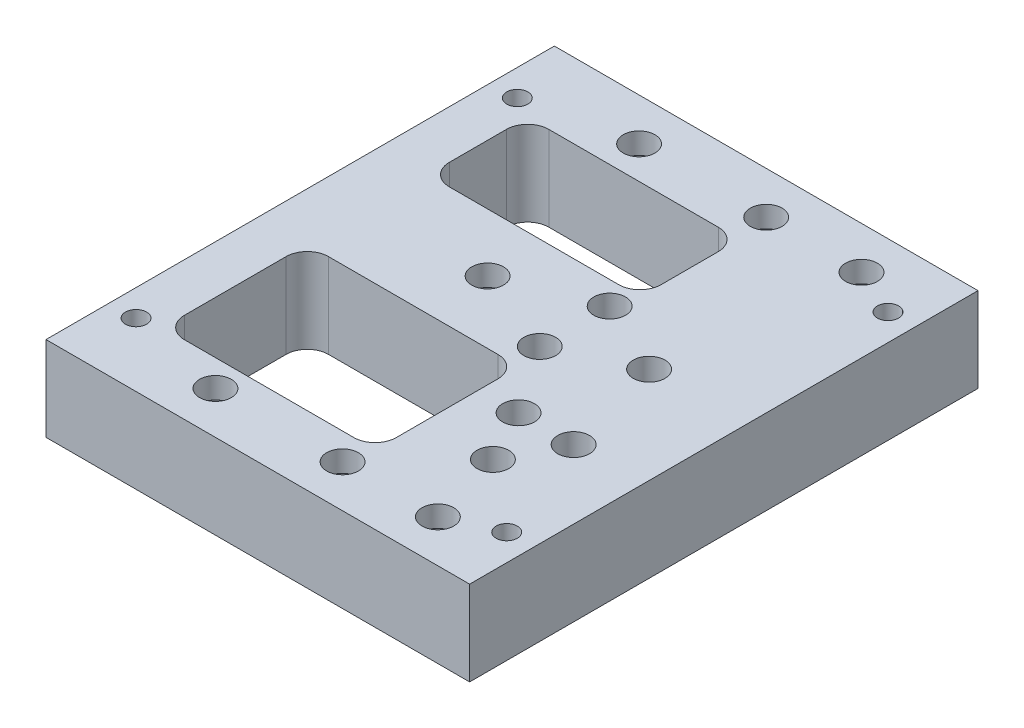
from build123d import *

# Parameters (mm, degrees)
SKETCH1_W                    = 200
SKETCH1_H                    = 240
BOSS_EXTRUDE1_DEPTH          = 40
CUT_EXTRUDE2_REACH           = 163.245
SKETCH3_R                    = 7.5
SKETCH4_R                    = 9
CUT_EXTRUDE3_DEPTH           = 5
SKETCH11_R                   = 7.5
CUT_EXTRUDE9_DEPTH           = 228.946346538
SKETCH12_R                   = 10
CUT_EXTRUDE10_DEPTH          = 5
SKETCH13_R                   = 10
CUT_EXTRUDE11_DEPTH          = 30
M10_TAPPED_HOLE1_D           = 8.5
M10_TAPPED_HOLE1_DEPTH       = 27.5
M10_TAPPED_HOLE1_CSINK_D     = 10.05
M10_TAPPED_HOLE1_CSINK_ANGLE = 90
M10_TAPPED_HOLE1_TIP         = 2.553657631
F_10_0MM_DOWEL_HOLE2_D       = 10
CUT_EXTRUDE12_REACH          = 163.245
SKETCH28_R                   = 7.5
SKETCH29_R                   = 9
CUT_EXTRUDE13_DEPTH          = 30


with BuildPart() as part:
    # Sketch1 → Boss-Extrude1 (new body)
    with BuildSketch(Plane(origin=(0, 0, 0), x_dir=(1, 0, 0), z_dir=(0, 1, 0))):
        Rectangle(SKETCH1_W, SKETCH1_H)
    extrude(amount=-BOSS_EXTRUDE1_DEPTH)

    # Sketch3 → Cut-Extrude2 (cut, up to next)
    with BuildSketch(Plane(origin=(0, 0, 0), x_dir=(1, 0, 0), z_dir=(0, 1, 0)), mode=Mode.PRIVATE) as cut_extrude2_sk1:
        with Locations((19.38, 26.73)):
            Circle(SKETCH3_R)
    cut_extrude2_tool1 = extrude(cut_extrude2_sk1.sketch, amount=-CUT_EXTRUDE2_REACH, mode=Mode.PRIVATE) & part.part
    # Sketch3 → Cut-Extrude2 (cut, up to next)
    with BuildSketch(Plane(origin=(0, 0, 0), x_dir=(1, 0, 0), z_dir=(0, 1, 0)), mode=Mode.PRIVATE) as cut_extrude2_sk2:
        with Locations((19.38, -6.27)):
            Circle(SKETCH3_R)
    cut_extrude2_tool2 = extrude(cut_extrude2_sk2.sketch, amount=-CUT_EXTRUDE2_REACH, mode=Mode.PRIVATE) & part.part
    # Sketch3 → Cut-Extrude2 (cut, up to next)
    with BuildSketch(Plane(origin=(0, 0, 0), x_dir=(1, 0, 0), z_dir=(0, 1, 0)), mode=Mode.PRIVATE) as cut_extrude2_sk3:
        with Locations((54.5, -63.53)):
            Circle(SKETCH3_R)
    cut_extrude2_tool3 = extrude(cut_extrude2_sk3.sketch, amount=-CUT_EXTRUDE2_REACH, mode=Mode.PRIVATE) & part.part
    # Sketch3 → Cut-Extrude2 (cut, up to next)
    with BuildSketch(Plane(origin=(0, 0, 0), x_dir=(1, 0, 0), z_dir=(0, 1, 0)), mode=Mode.PRIVATE) as cut_extrude2_sk4:
        with Locations((67.5, -38.4)):
            Circle(SKETCH3_R)
    cut_extrude2_tool4 = extrude(cut_extrude2_sk4.sketch, amount=-CUT_EXTRUDE2_REACH, mode=Mode.PRIVATE) & part.part
    # Sketch3 → Cut-Extrude2 (cut, up to next)
    with BuildSketch(Plane(origin=(0, 0, 0), x_dir=(1, 0, 0), z_dir=(0, 1, 0)), mode=Mode.PRIVATE) as cut_extrude2_sk5:
        with Locations((41.5, -38.4)):
            Circle(SKETCH3_R)
    cut_extrude2_tool5 = extrude(cut_extrude2_sk5.sketch, amount=-CUT_EXTRUDE2_REACH, mode=Mode.PRIVATE) & part.part
    # Sketch3 → Cut-Extrude2 (cut, up to next)
    with BuildSketch(Plane(origin=(0, 0, 0), x_dir=(1, 0, 0), z_dir=(0, 1, 0)), mode=Mode.PRIVATE) as cut_extrude2_sk6:
        with BuildLine():
            Line((-67.245, 84.63), (12.755, 84.63))
            ThreePointArc((12.755, 84.63), (19.826067812, 81.701067812), (22.755, 74.63))
            Line((22.755, 74.63), (22.755, 47.63))
            ThreePointArc((22.755, 47.63), (19.826067812, 40.558932188), (12.755, 37.63))
            Line((12.755, 37.63), (-67.245, 37.63))
            ThreePointArc((-67.245, 37.63), (-74.316067812, 40.558932188), (-77.245, 47.63))
            Line((-77.245, 47.63), (-77.245, 74.63))
            ThreePointArc((-77.245, 74.63), (-74.316067812, 81.701067812), (-67.245, 84.63))
        make_face()
    cut_extrude2_tool6 = extrude(cut_extrude2_sk6.sketch, amount=-CUT_EXTRUDE2_REACH, mode=Mode.PRIVATE) & part.part
    # Sketch3 → Cut-Extrude2 (cut, up to next)
    with BuildSketch(Plane(origin=(0, 0, 0), x_dir=(1, 0, 0), z_dir=(0, 1, 0)), mode=Mode.PRIVATE) as cut_extrude2_sk7:
        with BuildLine():
            Line((-67.245, -19.4), (12.755, -19.4))
            ThreePointArc((12.755, -19.4), (19.826067812, -22.328932188), (22.755, -29.4))
            Line((22.755, -29.4), (22.755, -77.4))
            ThreePointArc((22.755, -77.4), (19.826067812, -84.471067812), (12.755, -87.4))
            Line((12.755, -87.4), (-67.245, -87.4))
            ThreePointArc((-67.245, -87.4), (-74.316067812, -84.471067812), (-77.245, -77.4))
            Line((-77.245, -77.4), (-77.245, -29.4))
            ThreePointArc((-77.245, -29.4), (-74.316067812, -22.328932188), (-67.245, -19.4))
        make_face()
    cut_extrude2_tool7 = extrude(cut_extrude2_sk7.sketch, amount=-CUT_EXTRUDE2_REACH, mode=Mode.PRIVATE) & part.part
    add(cut_extrude2_tool1.solids().sort_by_distance((19.38, 0, -26.73))[0], mode=Mode.SUBTRACT)
    add(cut_extrude2_tool2.solids().sort_by_distance((19.38, 0, 6.27))[0], mode=Mode.SUBTRACT)
    add(cut_extrude2_tool3.solids().sort_by_distance((54.5, 0, 63.53))[0], mode=Mode.SUBTRACT)
    add(cut_extrude2_tool4.solids().sort_by_distance((67.5, 0, 38.4))[0], mode=Mode.SUBTRACT)
    add(cut_extrude2_tool5.solids().sort_by_distance((41.5, 0, 38.4))[0], mode=Mode.SUBTRACT)
    add(cut_extrude2_tool6.solids().sort_by_distance((-27.245, 0, -61.13))[0], mode=Mode.SUBTRACT)
    add(cut_extrude2_tool7.solids().sort_by_distance((-27.245, 0, 53.4))[0], mode=Mode.SUBTRACT)

    # Sketch4 → Cut-Extrude3 (cut)
    with BuildSketch(Plane.XZ.offset(40)):
        with Locations((19.38, -26.73)):
            Circle(SKETCH4_R)
        with Locations((19.38, 6.27)):
            Circle(SKETCH4_R)
        with Locations((41.5, 38.4)):
            Circle(SKETCH4_R)
        with Locations((67.5, 38.4)):
            Circle(SKETCH4_R)
        with Locations((54.5, 63.53)):
            Circle(SKETCH4_R)
    extrude(amount=-CUT_EXTRUDE3_DEPTH, mode=Mode.SUBTRACT)

    # Sketch11 → Cut-Extrude9 (cut, through all)
    with BuildSketch(Plane(origin=(89.63, 0, 0), x_dir=(1, 0, 0), z_dir=(0, 1, 0))):
        with Locations((-35.13, 10.23)):
            Circle(SKETCH11_R)
        with Locations((-111.38, 10.23)):
            Circle(SKETCH11_R)
    extrude(amount=-CUT_EXTRUDE9_DEPTH, mode=Mode.SUBTRACT)

    # Sketch12 → Cut-Extrude10 (cut)
    with BuildSketch(Plane(origin=(89.63, -40, 0), x_dir=(1, 0, 0), z_dir=(0, -1, 0))):
        with Locations((-35.13, -10.23)):
            Circle(SKETCH12_R)
    extrude(amount=-CUT_EXTRUDE10_DEPTH, mode=Mode.SUBTRACT)

    # Sketch13 → Cut-Extrude11 (cut)
    with BuildSketch(Plane(origin=(89.63, -40, 0), x_dir=(1, 0, 0), z_dir=(0, -1, 0))):
        with Locations((-111.38, -10.23)):
            Circle(SKETCH13_R)
    extrude(amount=-CUT_EXTRUDE11_DEPTH, mode=Mode.SUBTRACT)

    # M10 Tapped Hole1
    with Locations(Plane(origin=(0, -40, 0), x_dir=(-1, 0, 0), z_dir=(0, -1, 0))):
        with Locations((-87.5, 107.5), (87.5, 107.5), (87.5, -107.5), (-87.5, -107.5)):
            CounterSinkHole(M10_TAPPED_HOLE1_D / 2, M10_TAPPED_HOLE1_CSINK_D / 2, depth=M10_TAPPED_HOLE1_DEPTH, counter_sink_angle=M10_TAPPED_HOLE1_CSINK_ANGLE)
            with Locations((0, 0, -(M10_TAPPED_HOLE1_DEPTH + M10_TAPPED_HOLE1_TIP / 2))):  # 118° drill point
                Cone(0, M10_TAPPED_HOLE1_D / 2, M10_TAPPED_HOLE1_TIP, mode=Mode.SUBTRACT)

    # Ø10.0mm Dowel Hole2 (through all)
    with Locations(Plane(origin=(0, -40, 0), x_dir=(-1, 0, 0), z_dir=(0, -1, 0))):
        with Locations((-87.5, 90), (87.5, 90), (87.5, -90), (-87.5, -90)):
            Hole(F_10_0MM_DOWEL_HOLE2_D / 2)

    # Sketch28 → Cut-Extrude12 (cut, up to next)
    with BuildSketch(Plane(origin=(0, 0, 0), x_dir=(1, 0, 0), z_dir=(0, 1, 0)), mode=Mode.PRIVATE) as cut_extrude12_sk1:
        with Locations((20, -100)):
            Circle(SKETCH28_R)
    cut_extrude12_tool1 = extrude(cut_extrude12_sk1.sketch, amount=-CUT_EXTRUDE12_REACH, mode=Mode.PRIVATE) & part.part
    # Sketch28 → Cut-Extrude12 (cut, up to next)
    with BuildSketch(Plane(origin=(0, 0, 0), x_dir=(1, 0, 0), z_dir=(0, 1, 0)), mode=Mode.PRIVATE) as cut_extrude12_sk2:
        with Locations((65, -100)):
            Circle(SKETCH28_R)
    cut_extrude12_tool2 = extrude(cut_extrude12_sk2.sketch, amount=-CUT_EXTRUDE12_REACH, mode=Mode.PRIVATE) & part.part
    # Sketch28 → Cut-Extrude12 (cut, up to next)
    with BuildSketch(Plane(origin=(0, 0, 0), x_dir=(1, 0, 0), z_dir=(0, 1, 0)), mode=Mode.PRIVATE) as cut_extrude12_sk3:
        with Locations((-40, -100)):
            Circle(SKETCH28_R)
    cut_extrude12_tool3 = extrude(cut_extrude12_sk3.sketch, amount=-CUT_EXTRUDE12_REACH, mode=Mode.PRIVATE) & part.part
    cut_extrude12_1 = cut_extrude12_tool1.solids().sort_by_distance((20, 0, 100))[0]
    add(cut_extrude12_1, mode=Mode.SUBTRACT)
    cut_extrude12_2 = cut_extrude12_tool2.solids().sort_by_distance((65, 0, 100))[0]
    add(cut_extrude12_2, mode=Mode.SUBTRACT)
    cut_extrude12_3 = cut_extrude12_tool3.solids().sort_by_distance((-40, 0, 100))[0]
    add(cut_extrude12_3, mode=Mode.SUBTRACT)
    cut_extrude12 = cut_extrude12_1 + cut_extrude12_2 + cut_extrude12_3  # Cut-Extrude12 as one shape, for the pattern or mirror that repeats it

    # Mirror1: Cut-Extrude12 across plane
    add(cut_extrude12.mirror(Plane.XY), mode=Mode.SUBTRACT)

    # Sketch29 → Cut-Extrude13 (cut)
    with BuildSketch(Plane.XZ.offset(40)):
        with Locations((-40, 100)):
            Circle(SKETCH29_R)
        with Locations((20, 100)):
            Circle(SKETCH29_R)
        with Locations((20, -100)):
            Circle(SKETCH29_R)
        with Locations((-40, -100)):
            Circle(SKETCH29_R)
        with Locations((65, 100)):
            Circle(SKETCH29_R)
        with Locations((65, -100)):
            Circle(SKETCH29_R)
    extrude(amount=-CUT_EXTRUDE13_DEPTH, mode=Mode.SUBTRACT)


solid = part.part
